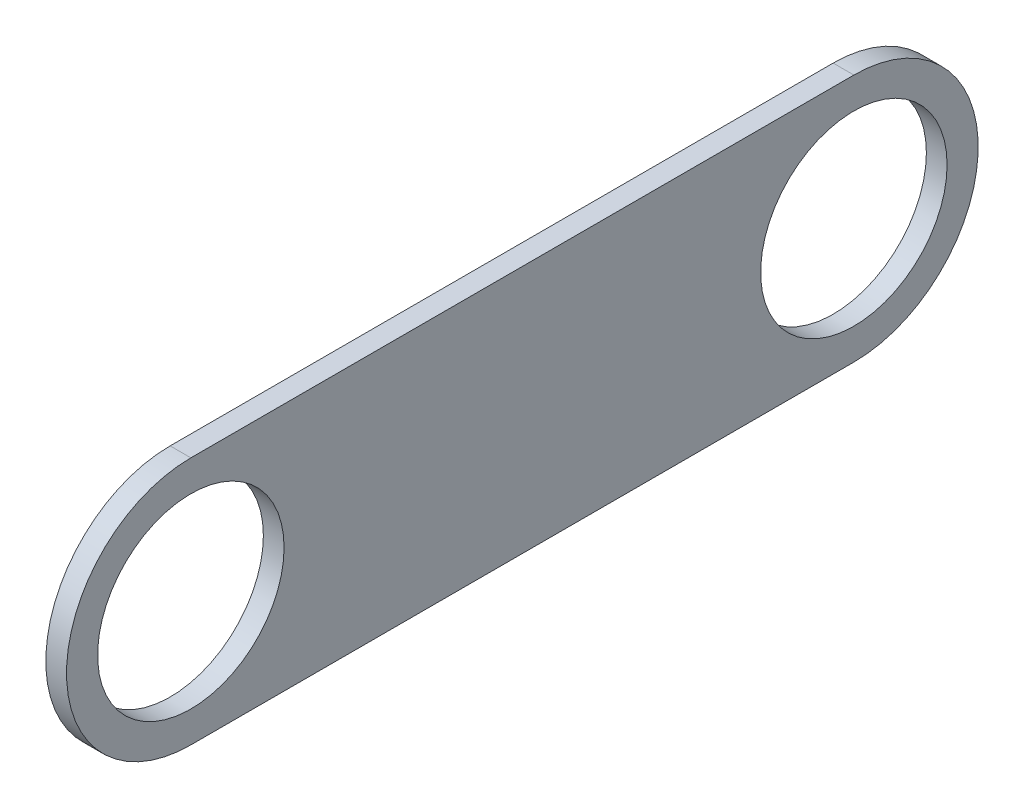
from build123d import *

# Parameters (mm, degrees)
SKETCH1_R           = 14.2875
BOSS_EXTRUDE1_DEPTH = 3.175


with BuildPart() as part:
    # Sketch1 → Boss-Extrude1 (new body)
    with BuildSketch(Plane(origin=(0, 0, 0), x_dir=(0, 0, -1), z_dir=(1, 0, 0))):
        with BuildLine():
            Line((-50.8, 19.05), (50.8, 19.05))
            ThreePointArc((50.8, 19.05), (69.85, 0), (50.8, -19.05))
            Line((50.8, -19.05), (-50.8, -19.05))
            ThreePointArc((-50.8, -19.05), (-69.85, 0), (-50.8, 19.05))
        make_face()
        with Locations((50.8, 0)):
            Circle(SKETCH1_R, mode=Mode.SUBTRACT)
        with Locations((-50.8, 0)):
            Circle(SKETCH1_R, mode=Mode.SUBTRACT)
    extrude(amount=BOSS_EXTRUDE1_DEPTH)


solid = part.part
